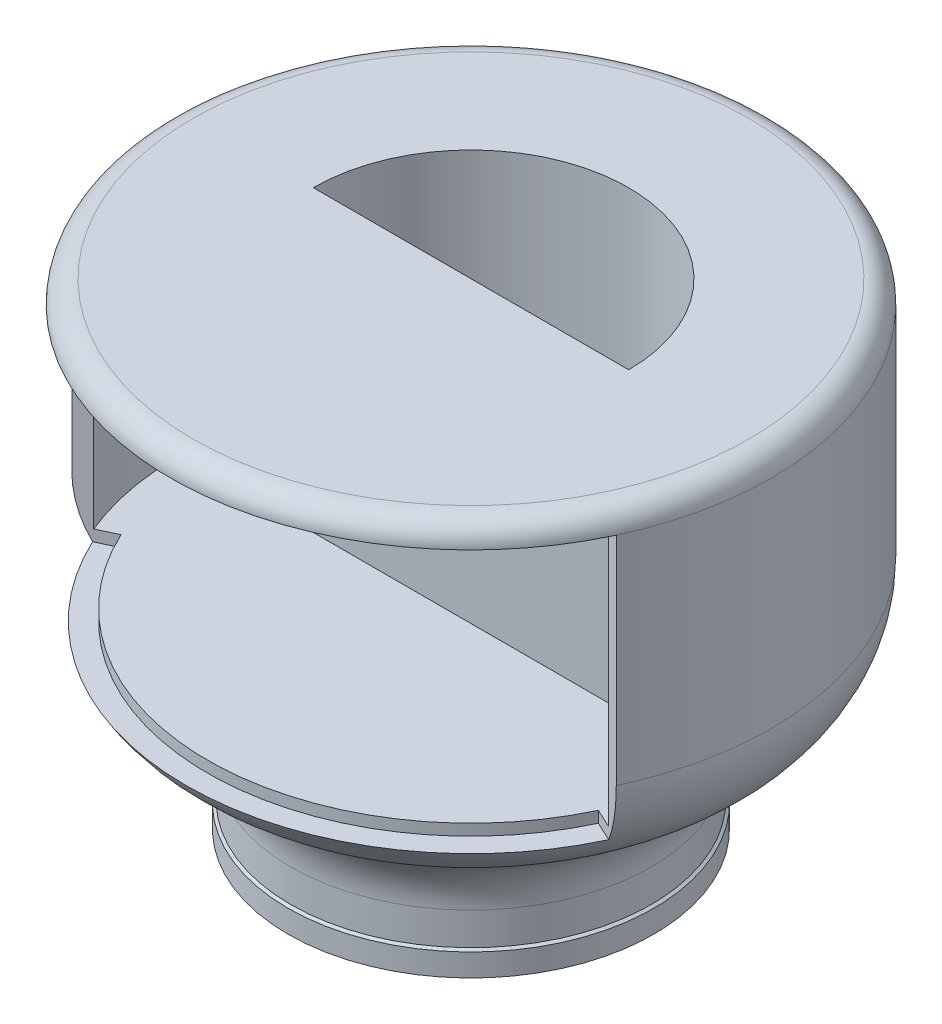
from build123d import *

# Parameters (mm, degrees)
CUT_EXTRUDE3_DEPTH           = 60
CUT_EXTRUDE5_DEPTH           = 2
CUT_EXTRUDE5_DEPTH_BACK      = 35
SKETCH19_W                   = 12
SKETCH19_H                   = 36.5
CUT_REVOLVE2_ANGLE           = 65
CUT_REVOLVE2_OTHER_WAY_ANGLE = 65


with BuildPart() as part:
    # Sketch1 → Revolve1 (revolve)
    with BuildSketch(Plane.XY):
        with BuildLine():
            Line((0, 63.427876097), (37, 63.427876097))
            ThreePointArc((37, 63.427876097), (39.121320344, 62.54919644), (40, 60.427876097))
            Line((40, 60.427876097), (40, 31.556288966))
            ThreePointArc((40, 31.556288966), (38.188122658, 24.409721904), (33.190210564, 18.989648567))
            Line((33.190210564, 18.989648567), (28.539859624, 15.958818353))
            ThreePointArc((28.539859624, 15.958818353), (25.207918228, 12.345436129), (24, 7.581058088))
            Line((24, 7.581058088), (24, 3.25))
            Line((24, 3.25), (24.35, 3))
            Line((24.35, 3), (24.35, 0))
            Line((24.35, 0), (22.5, 0))
            Line((22.5, 0), (22.5, 12.5))
            ThreePointArc((22.5, 12.5), (22.353553391, 12.853553391), (22, 13))
            Line((22, 13), (0, 13))
            Line((0, 13), (0, 63.427876097))
        make_face()
    revolve(axis=Axis((0, 0, 0), (0, 1, 0)))

    # Sketch11 → Cut-Extrude3 (cut)
    with BuildSketch(Plane(origin=(0, 13, 0), x_dir=(-1, 0, 0), z_dir=(0, -1, 0))):
        with BuildLine():
            Line((-21, 0), (21, 0))
            ThreePointArc((21, 0), (0, 21), (-21, 0))
        make_face()
    extrude(amount=-CUT_EXTRUDE3_DEPTH, mode=Mode.SUBTRACT)

    # Sketch9 → Cut-Extrude5 (cut, two sides: drawn at the far end of the back side and taken through both)
    with BuildSketch(Plane(origin=(0, 60.427876097, 0), x_dir=(1, 0, 0), z_dir=(0, 1, 0)).offset(-CUT_EXTRUDE5_DEPTH_BACK)):
        with BuildLine():
            ThreePointArc((-37, -1.601545046), (-0.398454954, -39), (37, -2.398454954))
            ThreePointArc((37, -2.398454954), (0.398454954, 35), (-37, -1.601545046))
        make_face()
        with BuildLine():
            Line((-24, -1.763080838), (24, -1.763080838))
            ThreePointArc((24, -1.763080838), (0, 24), (-24, -1.763080838))
        make_face(mode=Mode.SUBTRACT)
    extrude(amount=CUT_EXTRUDE5_DEPTH + CUT_EXTRUDE5_DEPTH_BACK, mode=Mode.SUBTRACT)

    # Sketch19 → Cut-Revolve2 (revolve, cut)
    with BuildSketch(Plane(origin=(0, 0, 0), x_dir=(0, 0, -1), z_dir=(1, 0, 0))):
        with Locations((-41.064715832, 42.177876097)):
            Rectangle(SKETCH19_W, SKETCH19_H)
    revolve(axis=Axis((0, 0, 0), (0, 1, 0)), revolution_arc=CUT_REVOLVE2_ANGLE, mode=Mode.SUBTRACT)

    # Sketch19 → Cut-Revolve2 other way (revolve, cut)
    with BuildSketch(Plane(origin=(0, 0, 0), x_dir=(0, 0, -1), z_dir=(1, 0, 0))):
        with Locations((-41.064715832, 42.177876097)):
            Rectangle(SKETCH19_W, SKETCH19_H)
    revolve(axis=Axis((0, 0, 0), (0, -1, 0)), revolution_arc=CUT_REVOLVE2_OTHER_WAY_ANGLE, mode=Mode.SUBTRACT)


solid = part.part
